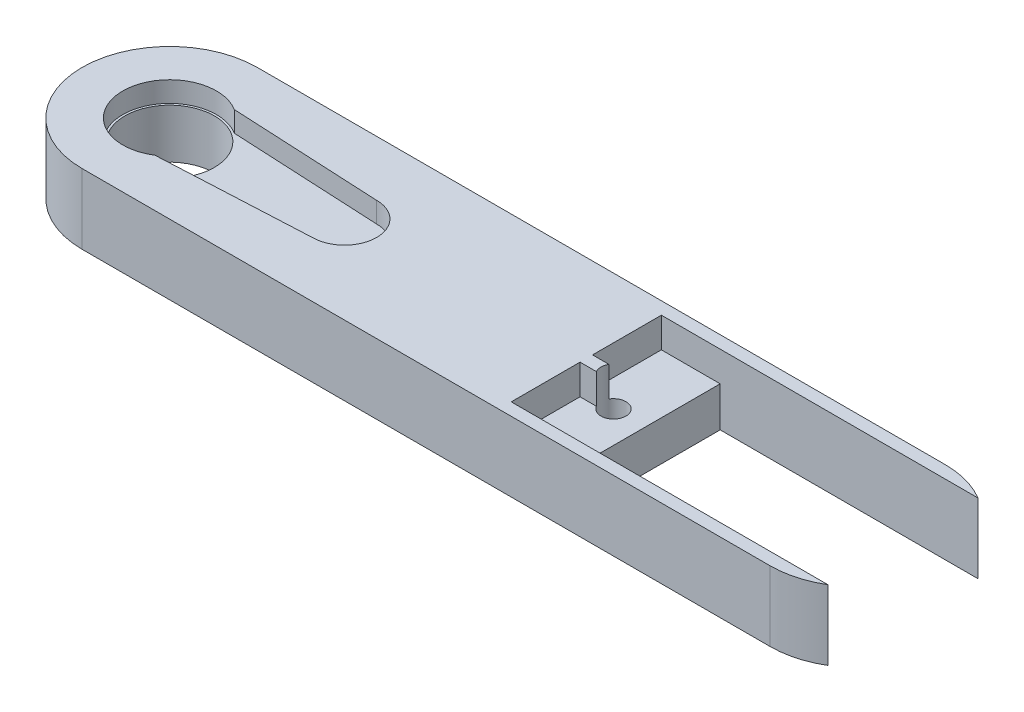
from build123d import *

# Parameters (mm, degrees)
BOSS_EXTRUDE1_DEPTH = 3.95
SKETCH2_R           = 3.575
CUT_EXTRUDE1_DEPTH  = 3.95
BOSS_EXTRUDE2_DEPTH = 1.64
SKETCH4_R           = 3.25
CUT_EXTRUDE2_DEPTH  = 63.643819328
CAVITY1_OUTLINE_R   = 3.25
CAVITY1_DEPTH       = 5.59
CAVITY1_START       = 3.19
CAVITY1_2_DEPTH     = 2.4
CUT_EXTRUDE4_DEPTH  = 63.643819328
CUT_EXTRUDE5_START  = -10
SKETCH6_R           = 1
CUT_EXTRUDE5_DEPTH  = 10


# Read off the part's stored shape, not the designer's step: Cavity1
with BuildPart() as part:
    # Sketch1 → Boss-Extrude1 (new body)
    with BuildSketch(Plane(origin=(0, 0, 0), x_dir=(1, 0, 0), z_dir=(0, 1, 0))):
        with BuildLine():
            Line((0, 7), (55, 7))
            ThreePointArc((55, 7), (62, 0), (55, -7))
            Line((55, -7), (0, -7))
            ThreePointArc((0, -7), (-7, 0), (0, 7))
        make_face()
    extrude(amount=BOSS_EXTRUDE1_DEPTH)

    # Sketch2 → Cut-Extrude1 (cut)
    with BuildSketch(Plane.XZ):
        with Locations(Location((0, 0, 0), (0, 0, 270))):
            Circle(SKETCH2_R)
    extrude(amount=-CUT_EXTRUDE1_DEPTH, mode=Mode.SUBTRACT)

    # Sketch3 → Boss-Extrude2 (add)
    with BuildSketch(Plane(origin=(0, 3.95, 0), x_dir=(1, 0, 0), z_dir=(0, 1, 0))):
        with BuildLine():
            Line((0, -7), (55, -7))
            ThreePointArc((55, -7), (62, 0), (55, 7))
            Line((55, 7), (0, 7))
            ThreePointArc((0, 7), (-7, 0), (0, -7))
        make_face()
        with BuildLine():
            Line((13.979308982, 2.569996388), (1.997926282, 3.167540934))
            ThreePointArc((1.997926282, 3.167540934), (-3.745, 0), (1.997926282, -3.167540934))
            Line((1.997926282, -3.167540934), (13.979308982, -2.569996388))
            ThreePointArc((13.979308982, -2.569996388), (16.545, 0), (13.979308982, 2.569996388))
        make_face(mode=Mode.SUBTRACT)
    extrude(amount=BOSS_EXTRUDE2_DEPTH)

    # Sketch4 → Cut-Extrude2 (cut, through all)
    with BuildSketch(Plane(origin=(0, 5.59, 0), x_dir=(1, 0, 0), z_dir=(0, 1, 0))):
        with Locations(Location((55, 0, 0), (0, 0, 270))):
            Circle(SKETCH4_R)
    extrude(amount=-CUT_EXTRUDE2_DEPTH, mode=Mode.SUBTRACT)

    # Cavity1 outline → Cavity1 (cut)
    with BuildSketch(Plane(origin=(0, 0, 0), x_dir=(1, 0, 0), z_dir=(0, 1, 0))):
        with BuildLine():
            Line((58.605551275, 6), (38, 6))
            Line((38, 6), (38, -6))
            Line((38, -6), (58.605551275, -6))
            ThreePointArc((58.605551275, -6), (59.949747468, -4.949747468), (61, -3.605551275))
            Line((61, -3.605551275), (61, 3.605551275))
            ThreePointArc((61, 3.605551275), (59.949747468, 4.949747468), (58.605551275, 6))
        make_face()
        with Locations((55, 0)):
            Circle(CAVITY1_OUTLINE_R, mode=Mode.SUBTRACT)
    extrude(amount=CAVITY1_DEPTH, mode=Mode.SUBTRACT)

    # Cavity1 2 outline → Cavity1 2 (cut)
    with BuildSketch(Plane(origin=(0, 0, 0), x_dir=(1, 0, 0), z_dir=(0, 1, 0)).offset(CAVITY1_START)):
        with BuildLine():
            Line((33.3, 0.5), (34.605619966, 0.5))
            ThreePointArc((34.605619966, 0.5), (36.47164537, 0), (34.605619966, -0.5))
            Line((34.605619966, -0.5), (33.3, -0.5))
            Line((33.3, -0.5), (33.3, -6))
            Line((33.3, -6), (38, -6))
            Line((38, -6), (38, 6))
            Line((38, 6), (33.3, 6))
            Line((33.3, 6), (33.3, 0.5))
        make_face()
        with BuildLine():
            ThreePointArc((61, -3.605551275), (62, 0), (61, 3.605551275))
            Line((61, 3.605551275), (61, -3.605551275))
        make_face()
    extrude(amount=CAVITY1_2_DEPTH, mode=Mode.SUBTRACT)

    # Sketch5 → Cut-Extrude4 (cut, through all)
    with BuildSketch(Plane.XZ):
        with BuildLine():
            Line((61, 3.605551275), (61, -3.605551275))
            ThreePointArc((61, -3.605551275), (62, 0), (61, 3.605551275))
        make_face()
    extrude(amount=-CUT_EXTRUDE4_DEPTH, mode=Mode.SUBTRACT)

    # Sketch6 → Cut-Extrude5 (cut)
    with BuildSketch(Plane(origin=(0, 5.59, 0), x_dir=(1, 0, 0), z_dir=(0, 1, 0)).offset(CUT_EXTRUDE5_START)):
        with Locations(Location((35.47164537, 0, 0), (0, 0, 270))):
            Circle(SKETCH6_R)
    extrude(amount=CUT_EXTRUDE5_DEPTH, mode=Mode.SUBTRACT)


solid = part.part
